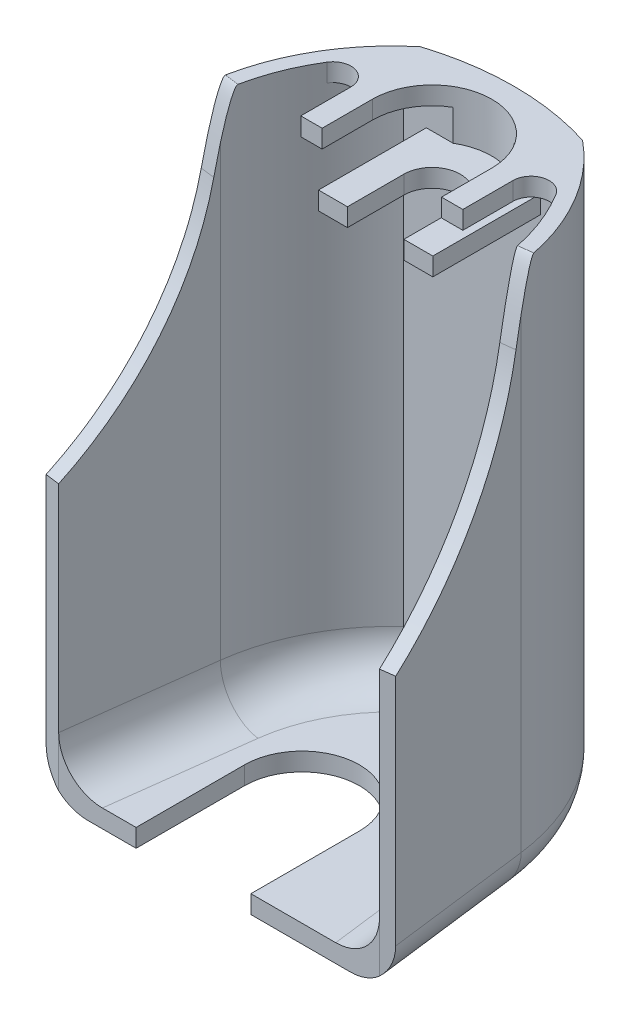
from build123d import *
from build123d.topology import SkipClean

# Parameters (mm, degrees)
BOSS_EXTRUDE1_DEPTH     = 3.175
BOSS_EXTRUDE2_DEPTH     = 3.175
BOSS_EXTRUDE3_DEPTH     = 21.0185
CUT_EXTRUDE1_START      = -8.636
CUT_EXTRUDE1_DEPTH      = 8.636
EXTRUDE_THIN2_START     = -97.232746
EXTRUDE_THIN2_DEPTH     = 97.232746
FILLET3_R               = 3.175
BOSS_EXTRUDE6_DEPTH     = 3.175
BOSS_EXTRUDE7_DEPTH     = 25.4
BOSS_EXTRUDE8_DEPTH     = 25.4
CUT_EXTRUDE2_START      = -2.540011
CUT_EXTRUDE2_DEPTH      = 2.540011
CUT_EXTRUDE3_DEPTH      = 111.05910553505677
CUT_EXTRUDE3_DEPTH_BACK = 10.921999999999981
BOSS_EXTRUDE10_DEPTH    = 3.175
CUT_EXTRUDE6_DEPTH      = 3.175
FILLET9_R               = 7.62
FILLET10_R              = 7.62


with BuildPart() as part:
    # Sketch1 → Boss-Extrude1 (new body)
    with BuildSketch(Plane(origin=(0, 0, 0), x_dir=(1, 0, 0), z_dir=(0, 1, 0))):
        with BuildLine():
            Line((-7.493000000000001, 9.017), (7.493000000000001, 9.017))
            Line((7.493000000000001, 9.017), (10.033000000000001, 9.017))
            Line((10.033000000000001, 9.017), (10.033000000000003, -9.907244149147685))
            Line((10.033000000000003, -9.907244149147685), (7.493000000000001, -9.907244149147685))
            Line((7.493000000000001, -9.907244149147685), (4.953000000000001, -9.907244149147685))
            Line((4.953000000000001, -9.907244149147685), (4.953000000000001, -7.493000000000001))
            Line((4.953000000000001, -7.493000000000001), (4.953000000000002, 0))
            ThreePointArc((4.953000000000002, 0), (3e-16, 4.953000000000002), (-4.953000000000002, 0))
            Line((-4.953000000000002, 0), (-4.953000000000002, -7.493000000000001))
            Line((-4.953000000000002, -7.493000000000001), (-4.953000000000002, -9.907244149147685))
            Line((-4.953000000000002, -9.907244149147685), (-7.493000000000001, -9.907244149147685))
            Line((-7.493000000000001, -9.907244149147685), (-10.033, -9.907244149147685))
            Line((-10.033, -9.907244149147685), (-10.033, 9.017))
            Line((-10.033, 9.017), (-7.493000000000001, 9.017))
        make_face()
    extrude(amount=BOSS_EXTRUDE1_DEPTH)

    # Sketch2 → Boss-Extrude2 (add)
    with BuildSketch(Plane(origin=(0, 0, -9.017), x_dir=(-1, 0, 0), z_dir=(0, 0, -1))):
        Polygon((-14.224, 11.811000000000002), (14.224, 11.810999999999998), (14.224000000000013, -85.42174573001641), (-14.224, -85.42174573001641), align=None)
    extrude(amount=BOSS_EXTRUDE2_DEPTH)

    # Sketch6 → Boss-Extrude3 (add)
    with BuildSketch(Plane.XY.offset(-12.191999999999998)):
        Polygon((-14.224000000000013, 11.810999999999998), (14.224000000000002, 11.811000000000002), (14.224000000000002, 8.635999999999997), (-14.224000000000013, 8.636), align=None)
    extrude(amount=BOSS_EXTRUDE3_DEPTH)

    # Sketch7 → Cut-Extrude1 (cut)
    with BuildSketch(Plane(origin=(-1.44e-15, 11.811, 0), x_dir=(1, 1.2e-16, -1.2e-16), z_dir=(-1.2e-16, 1, 0)).offset(CUT_EXTRUDE1_START)):
        with BuildLine():
            Line((-10.4775, 0), (-10.477499999999997, -8.826500000000003))
            Line((-10.477499999999997, -8.826500000000003), (10.477499999999997, -8.826500000000003))
            Line((10.477499999999997, -8.826500000000003), (10.4775, 0))
            ThreePointArc((10.4775, 0), (6.4e-16, 10.4775), (-10.4775, 0))
        make_face()
    extrude(amount=CUT_EXTRUDE1_DEPTH, mode=Mode.SUBTRACT)

    # Sketch9 → Extrude-Thin2 (add)
    with SkipClean():  # the faces are left unmerged after this step: merging them gives an invalid solid
        with BuildSketch(Plane(origin=(-1.44e-15, 11.811, 0), x_dir=(1, 1.2e-16, 0), z_dir=(-1.2e-16, 1, 0)).offset(EXTRUDE_THIN2_START)):
            with BuildLine():
                ThreePointArc((-27.495499999999996, -11.874500000000001), (-23.16361739518542, 1.4292204105375994), (-14.223999999999998, 12.191999999999998))
                ThreePointArc((-14.223999999999998, 12.191999999999998), (5.6e-15, 14.3950225515744), (14.224000000000002, 12.191999999999998))
                ThreePointArc((14.224000000000002, 12.191999999999998), (23.163617395185135, 1.4292204105374466), (27.495500000000003, -11.874500000000001))
                Line((27.495500000000003, -11.874500000000001), (24.975514198736292, -12.192731930247863))
                ThreePointArc((24.975514198736292, -12.192731930247863), (21.05665610983997, -0.0117588049320041), (12.985378631165648, 9.917391957485702))
                ThreePointArc((12.985378631165648, 9.917391957485702), (-2.419e-14, 11.8550225515744), (-12.985378631165693, 9.917391957485693))
                ThreePointArc((-12.985378631165693, 9.917391957485693), (-21.05665610984024, -0.01175880493180514), (-24.97551419873627, -12.192731930247744))
                Line((-24.97551419873627, -12.192731930247744), (-27.495499999999996, -11.874500000000001))
            make_face()
        extrude(amount=EXTRUDE_THIN2_DEPTH)

    # Fillet3
    fillet3_edges = [part.edges().sort_by_distance(p)[0] for p in [
        (14.223999999999988, 10.223500000000001, -8.81669380630742),
        (-14.224000000000025, 10.223500000000001, -8.81669380630752),
    ]]
    fillet(fillet3_edges, radius=FILLET3_R)

    # Sketch14 → Boss-Extrude6 (add)
    with SkipClean():  # the faces are left unmerged after this step: merging them gives an invalid solid
        with BuildSketch(Plane.XZ.offset(85.42174573001641)):
            with BuildLine():
                Line((-24.97551419873624, 12.192731930247724), (24.975514198736285, 12.19273193024785))
                ThreePointArc((24.975514198736285, 12.19273193024785), (21.375415433357674, 0.6135941010343018), (14.007321972391798, -9.017000000000001))
                Line((14.007321972391798, -9.017000000000001), (-14.007321972391907, -9.017000000000001))
                ThreePointArc((-14.007321972391907, -9.017000000000001), (-21.3754154333579, 0.613594101034149), (-24.97551419873624, 12.192731930247724))
            make_face()
        extrude(amount=-BOSS_EXTRUDE6_DEPTH)

    # Sketch16 → Boss-Extrude7 (add)
    with SkipClean():  # the faces are left unmerged after this step: merging them gives an invalid solid
        with BuildSketch(Plane(origin=(-1.907611771170577, -2.3e-16, 15.10582100900744), x_dir=(0.9921203941983182, 1.3600232051658164e-15, 0.125288161514861), z_dir=(-0.125288161514861, 0, 0.9921203941983182))):
            Polygon((-25.79111202477162, 11.811000000000032), (-23.25111202477174, 11.811000000000032), (-23.25111202477173, -85.42174573001638), (-25.791112024771614, -85.42174573001638), align=None)
        extrude(amount=BOSS_EXTRUDE7_DEPTH)

    # Sketch17 → Boss-Extrude8 (add)
    with SkipClean():  # the faces are left unmerged after this step: merging them gives an invalid solid
        with BuildSketch(Plane(origin=(1.9076117711714262, 2.3e-16, 15.105821009008544), x_dir=(0.9921203941983123, 0, -0.12528816151490688), z_dir=(0.12528816151490688, 0, 0.9921203941983123))):
            Polygon((23.251112024770936, 11.811000000000003), (25.791112024770936, 11.811000000000003), (25.791112024770946, -85.42174573001641), (23.251112024770947, -85.42174573001641), align=None)
        extrude(amount=BOSS_EXTRUDE8_DEPTH)

    # Sketch18 → Cut-Extrude2 (cut)
    with SkipClean():  # the faces are left unmerged after this step: merging them gives an invalid solid
        with BuildSketch(Plane(origin=(25.587888228828575, 2.68e-15, -3.2313210090085582), x_dir=(-0.12528816151490693, 0, -0.9921203941983123), z_dir=(0.9921203941983123, 0, -0.12528816151490693)).offset(CUT_EXTRUDE2_START)):
            with BuildLine():
                Line((-15.225794265840976, 11.811000000000003), (-40.62579426584097, 11.810999999999979))
                Line((-40.62579426584097, 11.810999999999979), (-40.625794265840945, -36.80537286500823))
                ThreePointArc((-40.625794265840945, -36.80537286500823), (-21.550219024017473, -15.828155025985357), (-15.225794265840976, 11.811000000000003))
            make_face()
        extrude(amount=CUT_EXTRUDE2_DEPTH, mode=Mode.SUBTRACT)

    # Sketch20 → Cut-Extrude3 (cut, two sides: drawn at the far end of the back side and taken through both)
    with SkipClean():  # the faces are left unmerged after this step: merging them gives an invalid solid
        with BuildSketch(Plane(origin=(-25.58788822882942, -3.721e-14, -3.2313210090074618), x_dir=(-0.125288161514861, 0, 0.9921203941983182), z_dir=(-0.9921203941983182, -1.4485191631463195e-15, -0.125288161514861)).offset(-CUT_EXTRUDE3_DEPTH_BACK)):
            with BuildLine():
                Line((22.0274881860901, 227.29057678360587), (15.225794265839772, 11.811000000000037))
                ThreePointArc((15.225794265839772, 11.811000000000037), (21.550219024016272, -15.828155025985314), (40.62579426583977, -36.8053728650082))
                Line((40.62579426583977, -36.8053728650082), (221.38768427622742, -154.29090461636542))
                Line((221.38768427622742, -154.29090461636542), (603.5471555949496, 45.37126677696938))
                Line((603.5471555949496, 45.37126677696938), (404.18695950481225, 426.95274817694064))
                Line((404.18695950481225, 426.95274817694064), (22.0274881860901, 227.29057678360587))
            make_face()
        extrude(amount=CUT_EXTRUDE3_DEPTH + CUT_EXTRUDE3_DEPTH_BACK, mode=Mode.SUBTRACT)

    # Fillet4
    # an asymmetric fillet: 13.335, 3.81 mm, written as the material it takes off along each edge
    with BuildSketch(Plane(origin=(58.84302061341704, 11.811000000000007, 7.915834047084794), x_dir=(-0.12528816151490632, 0, -0.9921203941983124), z_dir=(-0.9921203941983124, 0, 0.12528816151490632))) as fillet4_piece_1:
        with BuildLine():
            Bezier((2.7053520070494255, 0), (1.4569009522956595, 0), (-1.0323629375475052, 12.596361392197306), weights=[1, 0.7726151697313755, 1])
            ThreePointArc((-1.0323629375475052, 12.596361392197306), (-0.15891459016591844, 6.327461301251529), (0, 0))
            Line((0, 0), (2.7053520070494255, 0))
        make_face()
    extrude(amount=65.73297697483088, mode=Mode.SUBTRACT)
    with BuildSketch(Plane(origin=(6.372006414680967, 11.811, 16.151397883161476), x_dir=(0.12528816151485953, 0, -0.9921203941983183), z_dir=(-0.9921203941983183, 0, -0.12528816151485953))) as fillet4_piece_2:
        with BuildLine():
            Bezier((2.7053520070494144, 0), (1.4569009522956617, 0), (-1.0323629375475112, 12.596361392197299), weights=[1, 0.7726151697313756, 1])
            ThreePointArc((-1.0323629375475112, 12.596361392197299), (-0.1589145901659224, 6.327461301251536), (0, 0))
            Line((0, 0), (2.7053520070494144, 0))
        make_face()
    extrude(amount=65.7329769748309, mode=Mode.SUBTRACT)

    # Sketch24 → Boss-Extrude10 (add)
    with SkipClean():  # the faces are left unmerged after this step: merging them gives an invalid solid
        with BuildSketch(Plane.XZ.offset(85.42174573001641)):
            Polygon((-28.15783350121368, 37.39258994288504), (28.157833501214938, 37.392589942884996), (24.975514198736303, 12.192731930247856), (-24.975514198736246, 12.192731930247751), align=None)
        extrude(amount=-BOSS_EXTRUDE10_DEPTH)

    # Sketch26 → Cut-Extrude6 (cut)
    with SkipClean():  # the faces are left unmerged after this step: merging them gives an invalid solid
        with BuildSketch(Plane.XZ.offset(85.42174573001641)):
            with BuildLine():
                Line((-14.567389511213682, 37.392589942884996), (-14.56738951121368, 18.342589942884995))
                ThreePointArc((-14.56738951121368, 18.342589942884995), (-13.658413539575372, 14.16066011195614), (-11.095512732064424, 10.733370529984954))
                ThreePointArc((-11.095512732064424, 10.733370529984954), (-0.31106002656321863, 9.177166260801702), (5.581409796229526, 18.342589942884995))
                Line((5.581409796229526, 18.342589942884995), (5.581409796229526, 37.392589942884996))
                Line((5.581409796229526, 37.392589942884996), (-14.567389511213682, 37.392589942884996))
            make_face()
        extrude(amount=-CUT_EXTRUDE6_DEPTH, mode=Mode.SUBTRACT)

    # Fillet9
    # the kernel refuses this fillet: 7.62 mm, written as the material it takes off along each edge
    with BuildSketch(Plane(origin=(-27.49549999999986, -85.42174573001641, 11.8745), x_dir=(-1.4e-15, 1, -2.2e-16), z_dir=(-0.12528816151486097, 0, 0.9921203941983181))) as fillet9_piece_1:
        with BuildLine():
            CenterArc((FILLET9_R, -FILLET9_R), FILLET9_R, 90.00000000000003, 90)
            Line((3.41e-15, -FILLET9_R), (0, 0))
            Line((0, 0), (FILLET9_R, 0))
        make_face()
    extrude(amount=44.45000000000002, mode=Mode.SUBTRACT)
    with BuildSketch(Plane(origin=(9.413541961032127, -85.42174600000001, 16.535492796453063), x_dir=(-0.9921203941983183, 0, -0.12528816151485989), z_dir=(-0.12528816151485989, 0, 0.9921203941983183))) as fillet9_piece_2:
        with BuildLine():
            CenterArc((37.20218047816306 - FILLET9_R, -FILLET9_R), FILLET9_R, 0, 89.99999999999997)
            Line((37.20218047816306 - FILLET9_R, 0), (37.20218047816306, 0))
            Line((37.20218047816306, 0), (37.20218047816306, -FILLET9_R))
        make_face()
    revolve(axis=Axis((9.413541961032127, -85.42174600000001, 16.535492796453063), (1.2e-16, -1, 0)), revolution_arc=72.69638640364694, mode=Mode.SUBTRACT)
    with BuildSketch(Plane(origin=(1.219e-14, -85.42174600000001, 32.62571362170871), x_dir=(-0.6537161623893962, 0, -0.7567398357631774), z_dir=(-0.7567398357631774, 0, 0.6537161623893962))) as fillet9_piece_3:
        with BuildLine():
            CenterArc((47.020736173283105 - FILLET9_R, -FILLET9_R), FILLET9_R, 0, 90.00000000000006)
            Line((47.020736173283105 - FILLET9_R, 0), (47.020736173283105, 0))
            Line((47.020736173283105, 0), (47.02073617328311, -FILLET9_R))
        make_face()
    revolve(axis=Axis((1.219e-14, -85.42174600000001, 32.62571362170871), (1.2e-16, -1, 0)), revolution_arc=81.64474825482282, mode=Mode.SUBTRACT)
    with BuildSketch(Plane(origin=(-9.4135419610362, -85.42174600000001, 16.53549279645533), x_dir=(0.17547354297009532, 0, -0.984484147011785), z_dir=(-0.984484147011785, 0, -0.17547354297009532))) as fillet9_piece_4:
        with BuildLine():
            CenterArc((37.202180478167406 - FILLET9_R, -FILLET9_R), FILLET9_R, 0, 90)
            Line((37.202180478167406 - FILLET9_R, 0), (37.202180478167406, 0))
            Line((37.202180478167406, 0), (37.202180478167406, -FILLET9_R))
        make_face()
    revolve(axis=Axis((-9.4135419610362, -85.42174600000001, 16.53549279645533), (1.2e-16, -1, 0)), revolution_arc=72.69638640363817, mode=Mode.SUBTRACT)
    with BuildSketch(Plane(origin=(27.49550000000001, -85.42174573001641, 11.874499999999987), x_dir=(-4.6e-16, 1, 3e-17), z_dir=(0.12528816151490688, 0, 0.9921203941983123))) as fillet9_piece_5:
        with BuildLine():
            CenterArc((FILLET9_R, FILLET9_R), FILLET9_R, 179.99999999999994, 90)
            Line((1.774e-14, FILLET9_R), (0, 0))
            Line((0, 0), (FILLET9_R, 0))
        make_face()
    extrude(amount=44.450000000000045, mode=Mode.SUBTRACT)

    # Fillet10
    fillet10_edges = [part.edges().sort_by_distance(p)[0] for p in [
        (21.37541543335767, -82.24674573001641, 0.6135941010343018),
        (-26.566673849974965, -82.24674573001641, 24.792660936566392),
        (-21.3754154333579, -82.24674573001641, 0.6135941010341472),
        (-5.507e-14, -82.24674573001641, -9.017000000000001),
        (26.56667384997562, -82.24674573001641, 24.792660936566424),
    ]]
    fillet(fillet10_edges, radius=FILLET10_R)


solid = part.part
